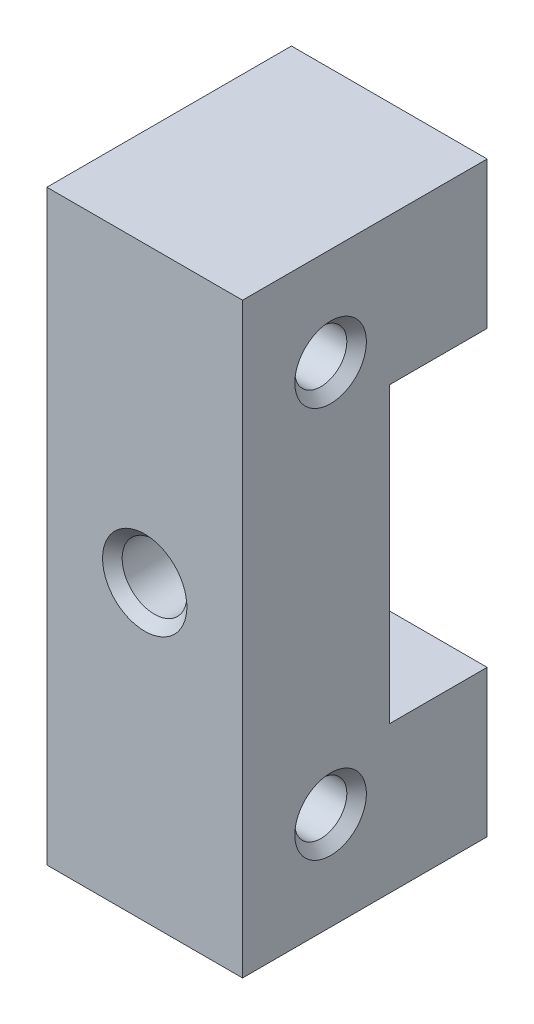
from build123d import *

# Parameters (mm, degrees)
BOSS_EXTRUDE1_DEPTH     = 12.7
F_1_4_CLEARANCE_HOLE1_D = 6.7564
M8_CLEARANCE_HOLE1_D    = 8.4
CHAMFER1_SIZE           = 1.27


with BuildPart() as part:
    # Sketch1 → Boss-Extrude1 (new, symmetric)
    with BuildSketch(Plane(origin=(0, 0, 0), x_dir=(0, 0, -1), z_dir=(1, 0, 0))):
        Polygon((-44.45, 241.3), (-12.7, 241.3), (-12.7, 260.35), (-25.4, 260.35), (-25.4, 298.45), (-12.7, 298.45), (-12.7, 317.5), (-44.45, 317.5), align=None)
    extrude(amount=BOSS_EXTRUDE1_DEPTH, both=True)

    # 1/4 Clearance Hole1 (through all)
    with Locations(Plane(origin=(12.7, 0, 0), x_dir=(0, 0, -1), z_dir=(1, 0, 0))):
        with Locations((-33.02, 304.8), (-33.02, 254)):
            Hole(F_1_4_CLEARANCE_HOLE1_D / 2)

    # M8 Clearance Hole1 (through all)
    with Locations(Plane(origin=(0, 0, 25.4), x_dir=(-1, 0, 0), z_dir=(0, 0, -1))):
        with Locations((0, 279.4)):
            Hole(M8_CLEARANCE_HOLE1_D / 2)

    # Chamfer1
    chamfer1_edges = [part.edges().sort_by_distance(p)[0] for p in [
        (-4.2, 279.4, 25.4),
        (-4.2, 279.4, 44.45),
        (12.7, 254, 29.6418),
        (-12.7, 254, 29.6418),
        (12.7, 304.8, 29.6418),
        (-12.7, 304.8, 29.6418),
    ]]
    chamfer(chamfer1_edges, length=CHAMFER1_SIZE)


solid = part.part
